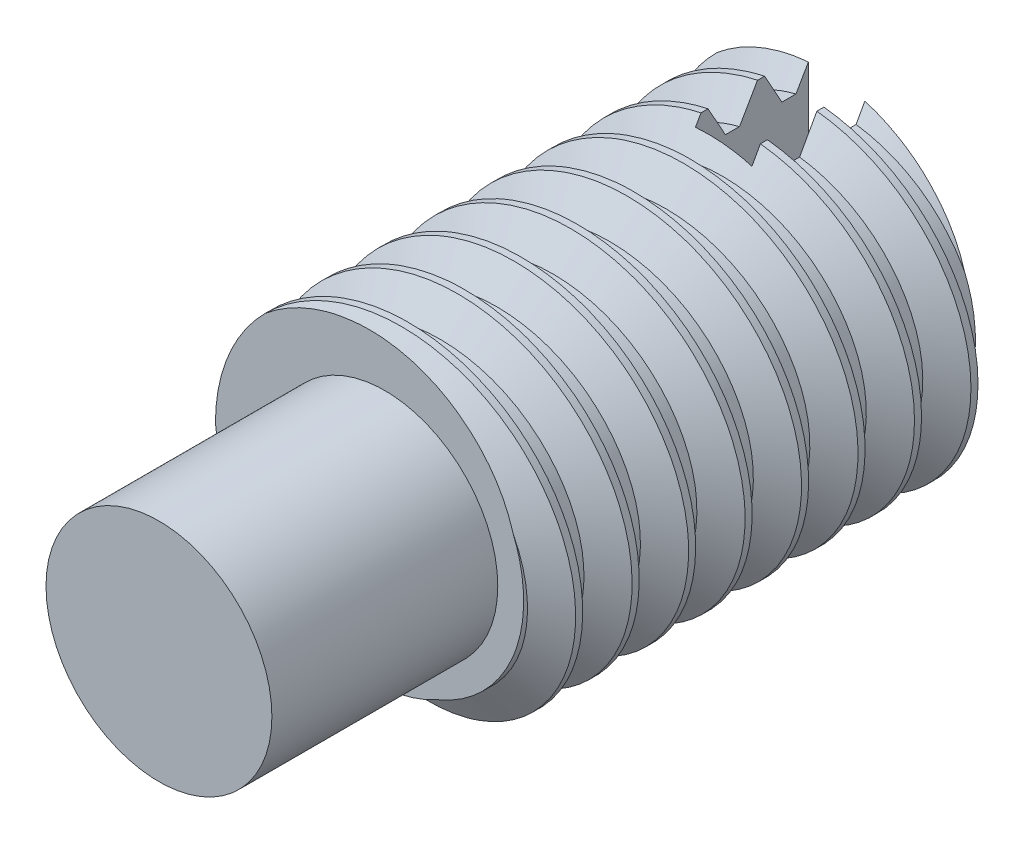
from build123d import *

# Parameters (mm, degrees)
SKETCH1_R           = 2
BOSS_EXTRUDE1_DEPTH = 12
SKETCH1_3_R         = 3
SKETCH1_3_R_2       = 2
BOSS_EXTRUDE2_DEPTH = 8
SKETCH2_W           = 1
SKETCH2_H           = 6.692106334
CUT_EXTRUDE1_DEPTH  = 2
THREAD1_PITCH       = 1


with BuildPart() as part:
    # Sketch1 → Boss-Extrude1 (new body)
    with BuildSketch(Plane.XY):
        Circle(SKETCH1_R)
    extrude(amount=BOSS_EXTRUDE1_DEPTH)

    # Sketch1<3> → Boss-Extrude2 (add)
    with BuildSketch(Plane.XY):
        Circle(SKETCH1_3_R)
        Circle(SKETCH1_3_R_2, mode=Mode.SUBTRACT)
    extrude(amount=BOSS_EXTRUDE2_DEPTH)

    # Sketch2 → Cut-Extrude1 (cut)
    with BuildSketch(Plane(origin=(0, 0, 0), x_dir=(-1, 0, 0), z_dir=(0, 0, -1))):
        Rectangle(SKETCH2_W, SKETCH2_H)
    extrude(amount=-CUT_EXTRUDE1_DEPTH, mode=Mode.SUBTRACT)

    # Thread1: the profile of Thread Profile1 profile screwed along a right-hand helix of 10 turns, 8 arcs to a turn; built about Z, then put on its axis
    thread1_z = Axis((0, 0, 0), (0, 0, 1))
    thread1_corners = [(3.0003, 0, -0.000173205), (3.0003, 0, 0.875173202), (2.458734125, 0, 0.562499999), (2.458734125, 0, 0.312499999)]
    with BuildLine(mode=Mode.PRIVATE) as thread1_profile:
        Line(thread1_corners[0], thread1_corners[1])
        Line(thread1_corners[1], thread1_corners[2])
        Line(thread1_corners[2], thread1_corners[3])
        Line(thread1_corners[3], thread1_corners[0])
    thread1_cap = Face(thread1_profile.wire())
    thread1_turn_angles = [0, 22.5, 45, 67.5, 90, 112.5, 135, 157.5, 180, 202.5, 225, 247.5, 270, 292.5, 315, 337.5, 360]
    thread1_turn_weights = [1, 0.9238795325112867, 1, 0.9238795325112867, 1, 0.9238795325112867, 1, 0.9238795325112867, 1, 0.9238795325112867, 1, 0.9238795325112867, 1, 0.9238795325112867, 1, 0.9238795325112867, 1]
    thread1_turn_rails = [Edge.make_bspline([Vector(p[0], p[1], 0).rotate(thread1_z, thread1_turn_angles[k]) / thread1_turn_weights[k] + Vector(0, 0, p[2] + THREAD1_PITCH * thread1_turn_angles[k] / 360) for k in range(17)], [0, 0, 0, 1, 1, 2, 2, 3, 3, 4, 4, 5, 5, 6, 6, 7, 7, 8, 8, 8], 2, thread1_turn_weights) for p in thread1_corners]
    thread1_turn_sides = [Face.make_surface_from_curves(thread1_turn_rails[p[0]], thread1_turn_rails[p[1]]) for p in [(0, 1), (1, 2), (2, 3), (3, 0)]]
    thread1 = Plane(origin=(0, 0, 9), x_dir=(-1, 0, 0), z_dir=(0, 0, -1)) * Solid(Shell([*[p.moved(Location((0, 0, THREAD1_PITCH * i))) for i in range(10) for p in thread1_turn_sides], thread1_cap, thread1_cap.rotate(thread1_z, 3600).moved(Location((0, 0, THREAD1_PITCH * 3600 / 360)))]))
    add(thread1, mode=Mode.SUBTRACT)


solid = part.part
